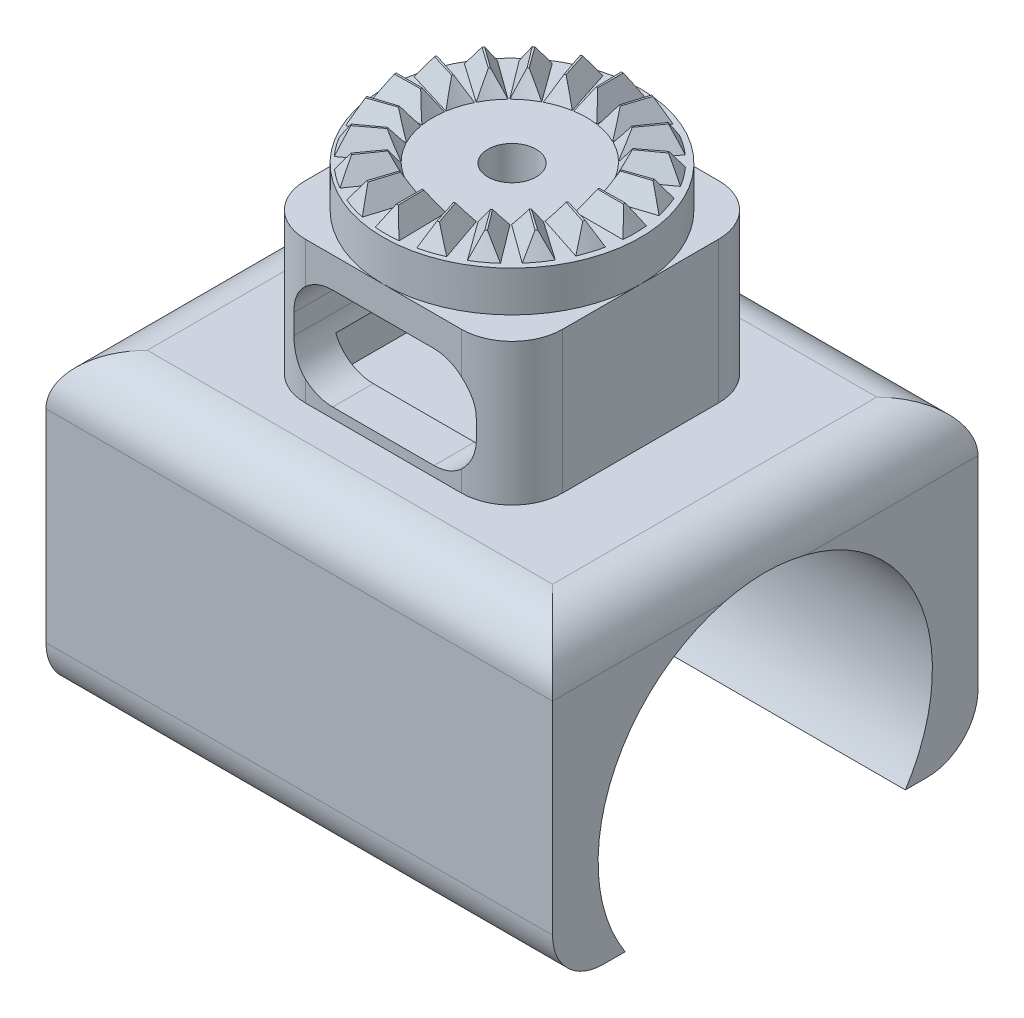
from build123d import *

# Parameters (mm, degrees)
CROQUIS1_W              = 12.7
CROQUIS1_H              = 10
SALIENTE_EXTRUIR1_DEPTH = 2
SALIENTE_EXTRUIR1_DRAFT = 28
MATRIZC1_COPY_1_DEPTH   = 2
MATRIZC1_COPY_1_DRAFT   = 28
MATRIZC1_COPY_2_DEPTH   = 2
MATRIZC1_COPY_2_DRAFT   = 28
MATRIZC1_COPY_3_DEPTH   = 2
MATRIZC1_COPY_3_DRAFT   = 28
MATRIZC1_COPY_4_DEPTH   = 2
MATRIZC1_COPY_4_DRAFT   = 28
MATRIZC1_COPY_5_DEPTH   = 2
MATRIZC1_COPY_5_DRAFT   = 28
MATRIZC1_COPY_6_DEPTH   = 2
MATRIZC1_COPY_6_DRAFT   = 28
MATRIZC1_COPY_7_DEPTH   = 2
MATRIZC1_COPY_7_DRAFT   = 28
MATRIZC1_COPY_8_DEPTH   = 2
MATRIZC1_COPY_8_DRAFT   = 28
MATRIZC1_COPY_9_DEPTH   = 2
MATRIZC1_COPY_9_DRAFT   = 28
MATRIZC1_COPY_10_DEPTH  = 2
MATRIZC1_COPY_10_DRAFT  = 28
MATRIZC1_COPY_11_DEPTH  = 2
MATRIZC1_COPY_11_DRAFT  = 28
MATRIZC1_COPY_12_DEPTH  = 2
MATRIZC1_COPY_12_DRAFT  = 28
MATRIZC1_COPY_13_DEPTH  = 2
MATRIZC1_COPY_13_DRAFT  = 28
MATRIZC1_COPY_14_DEPTH  = 2
MATRIZC1_COPY_14_DRAFT  = 28
MATRIZC1_COPY_15_DEPTH  = 2
MATRIZC1_COPY_15_DRAFT  = 28
MATRIZC1_COPY_16_DEPTH  = 2
MATRIZC1_COPY_16_DRAFT  = 28
MATRIZC1_COPY_17_DEPTH  = 2
MATRIZC1_COPY_17_DRAFT  = 28
MATRIZC1_COPY_18_DEPTH  = 2
MATRIZC1_COPY_18_DRAFT  = 28
MATRIZC1_COPY_19_DEPTH  = 2
MATRIZC1_COPY_19_DRAFT  = 28
CROQUIS3_W              = 25.4
CROQUIS3_H              = 25.4
SALIENTE_EXTRUIR2_DEPTH = 6
CROQUIS5_W              = 25.4
CROQUIS5_H              = 25.4
CROQUIS5_W_2            = 17.4
CROQUIS5_H_2            = 17.4
SALIENTE_EXTRUIR3_DEPTH = 8
CROQUIS7_W              = 50
CROQUIS7_H              = 30
SALIENTE_EXTRUIR4_DEPTH = 21
CORTAR_EXTRUIR2_DEPTH   = 72
REDONDEO2_R             = 5
CORTAR_EXTRUIR3_DEPTH   = 72
CROQUIS10_R             = 2.38125
CORTAR_EXTRUIR4_DEPTH   = 12
REDONDEO3_R             = 5
REDONDEO4_R             = 5


# Read off the part's stored shape, not the designer's step: Saliente-Extruir1
with BuildPart() as part:
    # Croquis1 → Revolución1 (revolve)
    with BuildSketch(Plane.XY, mode=Mode.PRIVATE) as revoluci_n1_sk:
        with Locations((-6.35, 5)):
            Rectangle(CROQUIS1_W, CROQUIS1_H)
    revolve(revoluci_n1_sk.sketch.rotate(Axis((0, -25.690422283, 0), (0, 1, 0)), 270), axis=Axis((0, -25.690422283, 0), (0, 1, 0)))


with BuildPart() as saliente_extruir1_tool:
    # Saliente-Extruir1 outline → Saliente-Extruir1 (with draft: the straight prism first)
    with BuildSketch(Plane(origin=(0, 12, 0), x_dir=(1, 0, 0), z_dir=(0, 1, 0))):
        with BuildLine():
            ThreePointArc((8.438714547, 0.14729831), (8.439678631, 0.07365196), (8.44, 0))
            Line((8.44, 0), (11, 0))
            ThreePointArc((11, 0), (10.999581154, 0.09599189), (10.998324647, 0.191976471))
            Line((10.998324647, 0.191976471), (8.438714547, 0.14729831))
        make_face()
    extrude(amount=-SALIENTE_EXTRUIR1_DEPTH)
    # Saliente-Extruir1: the draft: its side faces are tilted about the plane it starts from
    saliente_extruir1_sides = [saliente_extruir1_tool.faces().sort_by_distance(p)[0] for p in [
        (9.718519597, 11, -0.16963739),
        (8.439678631, 11, -0.073651959),
        (9.72, 11, 0),
        (10.999581154, 11, -0.095991891),
    ]]
    draft(saliente_extruir1_sides, Plane(origin=(0, 12, 0), x_dir=(1, 0, 0), z_dir=(0, 1, 0)), SALIENTE_EXTRUIR1_DRAFT)


with BuildPart() as part_1:
    add(part.part)

    # Saliente-Extruir1: add saliente_extruir1_tool
    add(saliente_extruir1_tool.part)


with BuildPart() as matrizc1_copy_1_tool:
    # MatrizC1 copy 1 sketch → MatrizC1 copy 1 (with draft: the straight prism first)
    with BuildSketch(Plane(origin=(-0.010903854, 12, -0.065158864), x_dir=(0.9510565162951535, 0, -0.3090169943749474), z_dir=(0, 1, 0))):
        with BuildLine():
            ThreePointArc((8.438714547, 0.14729831), (8.439678631, 0.07365196), (8.44, 0))
            Line((8.44, 0), (11, 0))
            ThreePointArc((11, 0), (10.999581154, 0.09599189), (10.998324647, 0.191976471))
            Line((10.998324647, 0.191976471), (8.438714547, 0.14729831))
        make_face()
    extrude(amount=-MATRIZC1_COPY_1_DEPTH)
    # MatrizC1 copy 1: the draft: its side faces are tilted about the plane it starts from
    matrizc1_copy_1_sides = [matrizc1_copy_1_tool.faces().sort_by_distance(p)[0] for p in [
        (9.179536701, 11, -3.229681324),
        (7.992947796, 11, -2.743210163),
        (9.233365484, 11, -3.068804049),
        (10.420656353, 11, -3.555510085),
    ]]
    draft(matrizc1_copy_1_sides, Plane(origin=(-0.010903854, 12, -0.065158864), x_dir=(0.9510565162951535, 0, -0.3090169943749474), z_dir=(0, 1, 0)), MATRIZC1_COPY_1_DRAFT)


with BuildPart() as part_2:
    add(part_1.part)

    # MatrizC1 copy 1: add matrizc1_copy_1_tool
    add(matrizc1_copy_1_tool.part)


with BuildPart() as matrizc1_copy_2_tool:
    # MatrizC1 copy 2 sketch → MatrizC1 copy 2 (with draft: the straight prism first)
    with BuildSketch(Plane(origin=(-0.041409232, 12, -0.123759149), x_dir=(0.8090169943749475, 0, -0.5877852522924731), z_dir=(0, 1, 0))):
        with BuildLine():
            ThreePointArc((8.438714547, 0.14729831), (8.439678631, 0.07365196), (8.44, 0))
            Line((8.44, 0), (11, 0))
            ThreePointArc((11, 0), (10.999581154, 0.09599189), (10.998324647, 0.191976471))
            Line((10.998324647, 0.191976471), (8.438714547, 0.14729831))
        make_face()
    extrude(amount=-MATRIZC1_COPY_2_DEPTH)
    # MatrizC1 copy 2: the draft: its side faces are tilted about the plane it starts from
    matrizc1_copy_2_sides = [matrizc1_copy_2_tool.faces().sort_by_distance(p)[0] for p in [
        (7.721327926, 11, -5.973401174),
        (6.743142672, 11, -5.144063469),
        (7.822235953, 11, -5.837031802),
        (8.801016235, 11, -6.666809804),
    ]]
    draft(matrizc1_copy_2_sides, Plane(origin=(-0.041409232, 12, -0.123759149), x_dir=(0.8090169943749475, 0, -0.5877852522924731), z_dir=(0, 1, 0)), MATRIZC1_COPY_2_DRAFT)


with BuildPart() as part_3:
    add(part_2.part)

    # MatrizC1 copy 2: add matrizc1_copy_2_tool
    add(matrizc1_copy_2_tool.part)


with BuildPart() as matrizc1_copy_3_tool:
    # MatrizC1 copy 3 sketch → MatrizC1 copy 3 (with draft: the straight prism first)
    with BuildSketch(Plane(origin=(-0.088530055, 12, -0.170064653), x_dir=(0.5877852522924731, 0, -0.8090169943749475), z_dir=(0, 1, 0))):
        with BuildLine():
            ThreePointArc((8.438714547, 0.14729831), (8.439678631, 0.07365196), (8.44, 0))
            Line((8.44, 0), (11, 0))
            ThreePointArc((11, 0), (10.999581154, 0.09599189), (10.998324647, 0.191976471))
            Line((10.998324647, 0.191976471), (8.438714547, 0.14729831))
        make_face()
    extrude(amount=-MATRIZC1_COPY_3_DEPTH)
    # MatrizC1 copy 3: the draft: its side faces are tilted about the plane it starts from
    matrizc1_copy_3_sides = [matrizc1_copy_3_tool.faces().sort_by_distance(p)[0] for p in [
        (5.486632907, 11, -8.132222523),
        (4.812602892, 11, -7.041199627),
        (5.624742598, 11, -8.033709838),
        (6.299202458, 11, -9.125335355),
    ]]
    draft(matrizc1_copy_3_sides, Plane(origin=(-0.088530055, 12, -0.170064653), x_dir=(0.5877852522924731, 0, -0.8090169943749475), z_dir=(0, 1, 0)), MATRIZC1_COPY_3_DRAFT)


with BuildPart() as part_4:
    add(part_3.part)

    # MatrizC1 copy 3: add matrizc1_copy_3_tool
    add(matrizc1_copy_3_tool.part)


with BuildPart() as matrizc1_copy_4_tool:
    # MatrizC1 copy 4 sketch → MatrizC1 copy 4 (with draft: the straight prism first)
    with BuildSketch(Plane(origin=(-0.147653807, 12, -0.199542668), x_dir=(0.30901699437494745, 0, -0.9510565162951535), z_dir=(0, 1, 0))):
        with BuildLine():
            ThreePointArc((8.438714547, 0.14729831), (8.439678631, 0.07365196), (8.44, 0))
            Line((8.44, 0), (11, 0))
            ThreePointArc((11, 0), (10.999581154, 0.09599189), (10.998324647, 0.191976471))
            Line((10.998324647, 0.191976471), (8.438714547, 0.14729831))
        make_face()
    extrude(amount=-MATRIZC1_COPY_4_DEPTH)
    # MatrizC1 copy 4: the draft: its side faces are tilted about the plane it starts from
    matrizc1_copy_4_sides = [matrizc1_copy_4_tool.faces().sort_by_distance(p)[0] for p in [
        (2.694199163, 11, -9.494824896),
        (2.390303141, 11, -8.248913733),
        (2.855991378, 11, -9.443812007),
        (3.160109987, 11, -10.690429127),
    ]]
    draft(matrizc1_copy_4_sides, Plane(origin=(-0.147653807, 12, -0.199542668), x_dir=(0.30901699437494745, 0, -0.9510565162951535), z_dir=(0, 1, 0)), MATRIZC1_COPY_4_DRAFT)


with BuildPart() as part_5:
    add(part_4.part)

    # MatrizC1 copy 4: add matrizc1_copy_4_tool
    add(matrizc1_copy_4_tool.part)


with BuildPart() as matrizc1_copy_5_tool:
    # MatrizC1 copy 5 sketch → MatrizC1 copy 5 (with draft: the straight prism first)
    with BuildSketch(Plane(origin=(-0.212993046, 12, -0.209307683), x_dir=(0, 0, -1), z_dir=(0, 1, 0))):
        with BuildLine():
            ThreePointArc((8.438714547, 0.14729831), (8.439678631, 0.07365196), (8.44, 0))
            Line((8.44, 0), (11, 0))
            ThreePointArc((11, 0), (10.999581154, 0.09599189), (10.998324647, 0.191976471))
            Line((10.998324647, 0.191976471), (8.438714547, 0.14729831))
        make_face()
    extrude(amount=-MATRIZC1_COPY_5_DEPTH)
    # MatrizC1 copy 5: the draft: its side faces are tilted about the plane it starts from
    matrizc1_copy_5_sides = [matrizc1_copy_5_tool.faces().sort_by_distance(p)[0] for p in [
        (-0.382630436, 11, -9.92782728),
        (-0.286645005, 11, -8.648986314),
        (-0.212993046, 11, -9.929307683),
        (-0.308984937, 11, -11.208888837),
    ]]
    draft(matrizc1_copy_5_sides, Plane(origin=(-0.212993046, 12, -0.209307683), x_dir=(0, 0, -1), z_dir=(0, 1, 0)), MATRIZC1_COPY_5_DRAFT)


with BuildPart() as part_6:
    add(part_5.part)

    # MatrizC1 copy 5: add matrizc1_copy_5_tool
    add(matrizc1_copy_5_tool.part)


with BuildPart() as matrizc1_copy_6_tool:
    # MatrizC1 copy 6 sketch → MatrizC1 copy 6 (with draft: the straight prism first)
    with BuildSketch(Plane(origin=(-0.278151909, 12, -0.198403829), x_dir=(-0.30901699437494734, 0, -0.9510565162951536), z_dir=(0, 1, 0))):
        with BuildLine():
            ThreePointArc((8.438714547, 0.14729831), (8.439678631, 0.07365196), (8.44, 0))
            Line((8.44, 0), (11, 0))
            ThreePointArc((11, 0), (10.999581154, 0.09599189), (10.998324647, 0.191976471))
            Line((10.998324647, 0.191976471), (8.438714547, 0.14729831))
        make_face()
    extrude(amount=-MATRIZC1_COPY_6_DEPTH)
    # MatrizC1 copy 6: the draft: its side faces are tilted about the plane it starts from
    matrizc1_copy_6_sides = [matrizc1_copy_6_tool.faces().sort_by_distance(p)[0] for p in [
        (-3.44267437, 11, -9.388844384),
        (-2.956203209, 11, -8.202255479),
        (-3.281797095, 11, -9.442673167),
        (-3.76850313, 11, -10.629964036),
    ]]
    draft(matrizc1_copy_6_sides, Plane(origin=(-0.278151909, 12, -0.198403829), x_dir=(-0.30901699437494734, 0, -0.9510565162951536), z_dir=(0, 1, 0)), MATRIZC1_COPY_6_DRAFT)


with BuildPart() as part_7:
    add(part_6.part)

    # MatrizC1 copy 6: add matrizc1_copy_6_tool
    add(matrizc1_copy_6_tool.part)


with BuildPart() as matrizc1_copy_7_tool:
    # MatrizC1 copy 7 sketch → MatrizC1 copy 7 (with draft: the straight prism first)
    with BuildSketch(Plane(origin=(-0.336752195, 12, -0.167898451), x_dir=(-0.587785252292473, 0, -0.8090169943749475), z_dir=(0, 1, 0))):
        with BuildLine():
            ThreePointArc((8.438714547, 0.14729831), (8.439678631, 0.07365196), (8.44, 0))
            Line((8.44, 0), (11, 0))
            ThreePointArc((11, 0), (10.999581154, 0.09599189), (10.998324647, 0.191976471))
            Line((10.998324647, 0.191976471), (8.438714547, 0.14729831))
        make_face()
    extrude(amount=-MATRIZC1_COPY_7_DEPTH)
    # MatrizC1 copy 7: the draft: its side faces are tilted about the plane it starts from
    matrizc1_copy_7_sides = [matrizc1_copy_7_tool.faces().sort_by_distance(p)[0] for p in [
        (-6.186394219, 11, -7.930635609),
        (-5.357056515, 11, -6.952450355),
        (-6.050024847, 11, -8.031543636),
        (-6.87980285, 11, -9.010323918),
    ]]
    draft(matrizc1_copy_7_sides, Plane(origin=(-0.336752195, 12, -0.167898451), x_dir=(-0.587785252292473, 0, -0.8090169943749475), z_dir=(0, 1, 0)), MATRIZC1_COPY_7_DRAFT)


with BuildPart() as part_8:
    add(part_7.part)

    # MatrizC1 copy 7: add matrizc1_copy_7_tool
    add(matrizc1_copy_7_tool.part)


with BuildPart() as matrizc1_copy_8_tool:
    # MatrizC1 copy 8 sketch → MatrizC1 copy 8 (with draft: the straight prism first)
    with BuildSketch(Plane(origin=(-0.383057698, 12, -0.120777628), x_dir=(-0.8090169943749473, 0, -0.5877852522924732), z_dir=(0, 1, 0))):
        with BuildLine():
            ThreePointArc((8.438714547, 0.14729831), (8.439678631, 0.07365196), (8.44, 0))
            Line((8.44, 0), (11, 0))
            ThreePointArc((11, 0), (10.999581154, 0.09599189), (10.998324647, 0.191976471))
            Line((10.998324647, 0.191976471), (8.438714547, 0.14729831))
        make_face()
    extrude(amount=-MATRIZC1_COPY_8_DEPTH)
    # MatrizC1 copy 8: the draft: its side faces are tilted about the plane it starts from
    matrizc1_copy_8_sides = [matrizc1_copy_8_tool.faces().sort_by_distance(p)[0] for p in [
        (-8.345215568, 11, -5.69594059),
        (-7.254192673, 11, -5.021910575),
        (-8.246702884, 11, -5.834050281),
        (-9.338328401, 11, -6.508510141),
    ]]
    draft(matrizc1_copy_8_sides, Plane(origin=(-0.383057698, 12, -0.120777628), x_dir=(-0.8090169943749473, 0, -0.5877852522924732), z_dir=(0, 1, 0)), MATRIZC1_COPY_8_DRAFT)


with BuildPart() as part_9:
    add(part_8.part)

    # MatrizC1 copy 8: add matrizc1_copy_8_tool
    add(matrizc1_copy_8_tool.part)


with BuildPart() as matrizc1_copy_9_tool:
    # MatrizC1 copy 9 sketch → MatrizC1 copy 9 (with draft: the straight prism first)
    with BuildSketch(Plane(origin=(-0.412535714, 12, -0.061653876), x_dir=(-0.9510565162951535, 0, -0.3090169943749475), z_dir=(0, 1, 0))):
        with BuildLine():
            ThreePointArc((8.438714547, 0.14729831), (8.439678631, 0.07365196), (8.44, 0))
            Line((8.44, 0), (11, 0))
            ThreePointArc((11, 0), (10.999581154, 0.09599189), (10.998324647, 0.191976471))
            Line((10.998324647, 0.191976471), (8.438714547, 0.14729831))
        make_face()
    extrude(amount=-MATRIZC1_COPY_9_DEPTH)
    # MatrizC1 copy 9: the draft: its side faces are tilted about the plane it starts from
    matrizc1_copy_9_sides = [matrizc1_copy_9_tool.faces().sort_by_distance(p)[0] for p in [
        (-9.707817942, 11, -2.903506846),
        (-8.461906778, 11, -2.599610824),
        (-9.656805052, 11, -3.065299061),
        (-10.903422173, 11, -3.36941767),
    ]]
    draft(matrizc1_copy_9_sides, Plane(origin=(-0.412535714, 12, -0.061653876), x_dir=(-0.9510565162951535, 0, -0.3090169943749475), z_dir=(0, 1, 0)), MATRIZC1_COPY_9_DRAFT)


with BuildPart() as part_10:
    add(part_9.part)

    # MatrizC1 copy 9: add matrizc1_copy_9_tool
    add(matrizc1_copy_9_tool.part)


with BuildPart() as matrizc1_copy_10_tool:
    # MatrizC1 copy 10 sketch → MatrizC1 copy 10 (with draft: the straight prism first)
    with BuildSketch(Plane(origin=(-0.422300729, 12, 0.003685363), x_dir=(-1, 0, 0), z_dir=(0, 1, 0))):
        with BuildLine():
            ThreePointArc((8.438714547, 0.14729831), (8.439678631, 0.07365196), (8.44, 0))
            Line((8.44, 0), (11, 0))
            ThreePointArc((11, 0), (10.999581154, 0.09599189), (10.998324647, 0.191976471))
            Line((10.998324647, 0.191976471), (8.438714547, 0.14729831))
        make_face()
    extrude(amount=-MATRIZC1_COPY_10_DEPTH)
    # MatrizC1 copy 10: the draft: its side faces are tilted about the plane it starts from
    matrizc1_copy_10_sides = [matrizc1_copy_10_tool.faces().sort_by_distance(p)[0] for p in [
        (-10.140820326, 11, 0.173322753),
        (-8.86197936, 11, 0.077337322),
        (-10.142300729, 11, 0.003685363),
        (-11.421881883, 11, 0.099677254),
    ]]
    draft(matrizc1_copy_10_sides, Plane(origin=(-0.422300729, 12, 0.003685363), x_dir=(-1, 0, 0), z_dir=(0, 1, 0)), MATRIZC1_COPY_10_DRAFT)


with BuildPart() as part_11:
    add(part_10.part)

    # MatrizC1 copy 10: add matrizc1_copy_10_tool
    add(matrizc1_copy_10_tool.part)


with BuildPart() as matrizc1_copy_11_tool:
    # MatrizC1 copy 11 sketch → MatrizC1 copy 11 (with draft: the straight prism first)
    with BuildSketch(Plane(origin=(-0.411396874, 12, 0.068844226), x_dir=(-0.9510565162951536, 0, 0.3090169943749473), z_dir=(0, 1, 0))):
        with BuildLine():
            ThreePointArc((8.438714547, 0.14729831), (8.439678631, 0.07365196), (8.44, 0))
            Line((8.44, 0), (11, 0))
            ThreePointArc((11, 0), (10.999581154, 0.09599189), (10.998324647, 0.191976471))
            Line((10.998324647, 0.191976471), (8.438714547, 0.14729831))
        make_face()
    extrude(amount=-MATRIZC1_COPY_11_DEPTH)
    # MatrizC1 copy 11: the draft: its side faces are tilted about the plane it starts from
    matrizc1_copy_11_sides = [matrizc1_copy_11_tool.faces().sort_by_distance(p)[0] for p in [
        (-9.601837429, 11, 3.233366687),
        (-8.415248525, 11, 2.746895526),
        (-9.655666213, 11, 3.072489412),
        (-10.842957082, 11, 3.559195447),
    ]]
    draft(matrizc1_copy_11_sides, Plane(origin=(-0.411396874, 12, 0.068844226), x_dir=(-0.9510565162951536, 0, 0.3090169943749473), z_dir=(0, 1, 0)), MATRIZC1_COPY_11_DRAFT)


with BuildPart() as part_12:
    add(part_11.part)

    # MatrizC1 copy 11: add matrizc1_copy_11_tool
    add(matrizc1_copy_11_tool.part)


with BuildPart() as matrizc1_copy_12_tool:
    # MatrizC1 copy 12 sketch → MatrizC1 copy 12 (with draft: the straight prism first)
    with BuildSketch(Plane(origin=(-0.380891496, 12, 0.127444512), x_dir=(-0.8090169943749476, 0, 0.587785252292473), z_dir=(0, 1, 0))):
        with BuildLine():
            ThreePointArc((8.438714547, 0.14729831), (8.439678631, 0.07365196), (8.44, 0))
            Line((8.44, 0), (11, 0))
            ThreePointArc((11, 0), (10.999581154, 0.09599189), (10.998324647, 0.191976471))
            Line((10.998324647, 0.191976471), (8.438714547, 0.14729831))
        make_face()
    extrude(amount=-MATRIZC1_COPY_12_DEPTH)
    # MatrizC1 copy 12: the draft: its side faces are tilted about the plane it starts from
    matrizc1_copy_12_sides = [matrizc1_copy_12_tool.faces().sort_by_distance(p)[0] for p in [
        (-8.143628654, 11, 5.977086537),
        (-7.165443401, 11, 5.147748832),
        (-8.244536682, 11, 5.840717164),
        (-9.223316963, 11, 6.670495167),
    ]]
    draft(matrizc1_copy_12_sides, Plane(origin=(-0.380891496, 12, 0.127444512), x_dir=(-0.8090169943749476, 0, 0.587785252292473), z_dir=(0, 1, 0)), MATRIZC1_COPY_12_DRAFT)


with BuildPart() as part_13:
    add(part_12.part)

    # MatrizC1 copy 12: add matrizc1_copy_12_tool
    add(matrizc1_copy_12_tool.part)


with BuildPart() as matrizc1_copy_13_tool:
    # MatrizC1 copy 13 sketch → MatrizC1 copy 13 (with draft: the straight prism first)
    with BuildSketch(Plane(origin=(-0.333770674, 12, 0.173750015), x_dir=(-0.5877852522924732, 0, 0.8090169943749473), z_dir=(0, 1, 0))):
        with BuildLine():
            ThreePointArc((8.438714547, 0.14729831), (8.439678631, 0.07365196), (8.44, 0))
            Line((8.44, 0), (11, 0))
            ThreePointArc((11, 0), (10.999581154, 0.09599189), (10.998324647, 0.191976471))
            Line((10.998324647, 0.191976471), (8.438714547, 0.14729831))
        make_face()
    extrude(amount=-MATRIZC1_COPY_13_DEPTH)
    # MatrizC1 copy 13: the draft: its side faces are tilted about the plane it starts from
    matrizc1_copy_13_sides = [matrizc1_copy_13_tool.faces().sort_by_distance(p)[0] for p in [
        (-5.908933636, 11, 8.135907885),
        (-5.234903621, 11, 7.04488499),
        (-6.047043326, 11, 8.037395201),
        (-6.721503186, 11, 9.129020718),
    ]]
    draft(matrizc1_copy_13_sides, Plane(origin=(-0.333770674, 12, 0.173750015), x_dir=(-0.5877852522924732, 0, 0.8090169943749473), z_dir=(0, 1, 0)), MATRIZC1_COPY_13_DRAFT)


with BuildPart() as part_14:
    add(part_13.part)

    # MatrizC1 copy 13: add matrizc1_copy_13_tool
    add(matrizc1_copy_13_tool.part)


with BuildPart() as matrizc1_copy_14_tool:
    # MatrizC1 copy 14 sketch → MatrizC1 copy 14 (with draft: the straight prism first)
    with BuildSketch(Plane(origin=(-0.274646921, 12, 0.203228031), x_dir=(-0.30901699437494756, 0, 0.9510565162951535), z_dir=(0, 1, 0))):
        with BuildLine():
            ThreePointArc((8.438714547, 0.14729831), (8.439678631, 0.07365196), (8.44, 0))
            Line((8.44, 0), (11, 0))
            ThreePointArc((11, 0), (10.999581154, 0.09599189), (10.998324647, 0.191976471))
            Line((10.998324647, 0.191976471), (8.438714547, 0.14729831))
        make_face()
    extrude(amount=-MATRIZC1_COPY_14_DEPTH)
    # MatrizC1 copy 14: the draft: its side faces are tilted about the plane it starts from
    matrizc1_copy_14_sides = [matrizc1_copy_14_tool.faces().sort_by_distance(p)[0] for p in [
        (-3.116499892, 11, 9.498510259),
        (-2.81260387, 11, 8.252599095),
        (-3.278292106, 11, 9.447497369),
        (-3.582410715, 11, 10.69411449),
    ]]
    draft(matrizc1_copy_14_sides, Plane(origin=(-0.274646921, 12, 0.203228031), x_dir=(-0.30901699437494756, 0, 0.9510565162951535), z_dir=(0, 1, 0)), MATRIZC1_COPY_14_DRAFT)


with BuildPart() as part_15:
    add(part_14.part)

    # MatrizC1 copy 14: add matrizc1_copy_14_tool
    add(matrizc1_copy_14_tool.part)


with BuildPart() as matrizc1_copy_15_tool:
    # MatrizC1 copy 15 sketch → MatrizC1 copy 15 (with draft: the straight prism first)
    with BuildSketch(Plane(origin=(-0.209307683, 12, 0.212993046), x_dir=(0, 0, 1), z_dir=(0, 1, 0))):
        with BuildLine():
            ThreePointArc((8.438714547, 0.14729831), (8.439678631, 0.07365196), (8.44, 0))
            Line((8.44, 0), (11, 0))
            ThreePointArc((11, 0), (10.999581154, 0.09599189), (10.998324647, 0.191976471))
            Line((10.998324647, 0.191976471), (8.438714547, 0.14729831))
        make_face()
    extrude(amount=-MATRIZC1_COPY_15_DEPTH)
    # MatrizC1 copy 15: the draft: its side faces are tilted about the plane it starts from
    matrizc1_copy_15_sides = [matrizc1_copy_15_tool.faces().sort_by_distance(p)[0] for p in [
        (-0.039670293, 11, 9.931512643),
        (-0.135655724, 11, 8.652671677),
        (-0.209307683, 11, 9.932993046),
        (-0.113315792, 11, 11.2125742),
    ]]
    draft(matrizc1_copy_15_sides, Plane(origin=(-0.209307683, 12, 0.212993046), x_dir=(0, 0, 1), z_dir=(0, 1, 0)), MATRIZC1_COPY_15_DRAFT)


with BuildPart() as part_16:
    add(part_15.part)

    # MatrizC1 copy 15: add matrizc1_copy_15_tool
    add(matrizc1_copy_15_tool.part)


with BuildPart() as matrizc1_copy_16_tool:
    # MatrizC1 copy 16 sketch → MatrizC1 copy 16 (with draft: the straight prism first)
    with BuildSketch(Plane(origin=(-0.144148819, 12, 0.202089191), x_dir=(0.30901699437494723, 0, 0.9510565162951536), z_dir=(0, 1, 0))):
        with BuildLine():
            ThreePointArc((8.438714547, 0.14729831), (8.439678631, 0.07365196), (8.44, 0))
            Line((8.44, 0), (11, 0))
            ThreePointArc((11, 0), (10.999581154, 0.09599189), (10.998324647, 0.191976471))
            Line((10.998324647, 0.191976471), (8.438714547, 0.14729831))
        make_face()
    extrude(amount=-MATRIZC1_COPY_16_DEPTH)
    # MatrizC1 copy 16: the draft: its side faces are tilted about the plane it starts from
    matrizc1_copy_16_sides = [matrizc1_copy_16_tool.faces().sort_by_distance(p)[0] for p in [
        (3.020373642, 11, 9.392529746),
        (2.53390248, 11, 8.205940842),
        (2.859496366, 11, 9.44635853),
        (3.346202402, 11, 10.633649399),
    ]]
    draft(matrizc1_copy_16_sides, Plane(origin=(-0.144148819, 12, 0.202089191), x_dir=(0.30901699437494723, 0, 0.9510565162951536), z_dir=(0, 1, 0)), MATRIZC1_COPY_16_DRAFT)


with BuildPart() as part_17:
    add(part_16.part)

    # MatrizC1 copy 16: add matrizc1_copy_16_tool
    add(matrizc1_copy_16_tool.part)


with BuildPart() as matrizc1_copy_17_tool:
    # MatrizC1 copy 17 sketch → MatrizC1 copy 17 (with draft: the straight prism first)
    with BuildSketch(Plane(origin=(-0.085548534, 12, 0.171583813), x_dir=(0.5877852522924729, 0, 0.8090169943749476), z_dir=(0, 1, 0))):
        with BuildLine():
            ThreePointArc((8.438714547, 0.14729831), (8.439678631, 0.07365196), (8.44, 0))
            Line((8.44, 0), (11, 0))
            ThreePointArc((11, 0), (10.999581154, 0.09599189), (10.998324647, 0.191976471))
            Line((10.998324647, 0.191976471), (8.438714547, 0.14729831))
        make_face()
    extrude(amount=-MATRIZC1_COPY_17_DEPTH)
    # MatrizC1 copy 17: the draft: its side faces are tilted about the plane it starts from
    matrizc1_copy_17_sides = [matrizc1_copy_17_tool.faces().sort_by_distance(p)[0] for p in [
        (5.764093491, 11, 7.934320972),
        (4.934755786, 11, 6.956135718),
        (5.627724119, 11, 8.035228999),
        (6.457502121, 11, 9.01400928),
    ]]
    draft(matrizc1_copy_17_sides, Plane(origin=(-0.085548534, 12, 0.171583813), x_dir=(0.5877852522924729, 0, 0.8090169943749476), z_dir=(0, 1, 0)), MATRIZC1_COPY_17_DRAFT)


with BuildPart() as part_18:
    add(part_17.part)

    # MatrizC1 copy 17: add matrizc1_copy_17_tool
    add(matrizc1_copy_17_tool.part)


with BuildPart() as matrizc1_copy_18_tool:
    # MatrizC1 copy 18 sketch → MatrizC1 copy 18 (with draft: the straight prism first)
    with BuildSketch(Plane(origin=(-0.03924303, 12, 0.124462991), x_dir=(0.8090169943749473, 0, 0.5877852522924734), z_dir=(0, 1, 0))):
        with BuildLine():
            ThreePointArc((8.438714547, 0.14729831), (8.439678631, 0.07365196), (8.44, 0))
            Line((8.44, 0), (11, 0))
            ThreePointArc((11, 0), (10.999581154, 0.09599189), (10.998324647, 0.191976471))
            Line((10.998324647, 0.191976471), (8.438714547, 0.14729831))
        make_face()
    extrude(amount=-MATRIZC1_COPY_18_DEPTH)
    # MatrizC1 copy 18: the draft: its side faces are tilted about the plane it starts from
    matrizc1_copy_18_sides = [matrizc1_copy_18_tool.faces().sort_by_distance(p)[0] for p in [
        (7.92291484, 11, 5.699625953),
        (6.831891945, 11, 5.025595938),
        (7.824402155, 11, 5.837735643),
        (8.916027672, 11, 6.512195504),
    ]]
    draft(matrizc1_copy_18_sides, Plane(origin=(-0.03924303, 12, 0.124462991), x_dir=(0.8090169943749473, 0, 0.5877852522924734), z_dir=(0, 1, 0)), MATRIZC1_COPY_18_DRAFT)


with BuildPart() as part_19:
    add(part_18.part)

    # MatrizC1 copy 18: add matrizc1_copy_18_tool
    add(matrizc1_copy_18_tool.part)


with BuildPart() as matrizc1_copy_19_tool:
    # MatrizC1 copy 19 sketch → MatrizC1 copy 19 (with draft: the straight prism first)
    with BuildSketch(Plane(origin=(-0.009765015, 12, 0.065339238), x_dir=(0.9510565162951535, 0, 0.3090169943749476), z_dir=(0, 1, 0))):
        with BuildLine():
            ThreePointArc((8.438714547, 0.14729831), (8.439678631, 0.07365196), (8.44, 0))
            Line((8.44, 0), (11, 0))
            ThreePointArc((11, 0), (10.999581154, 0.09599189), (10.998324647, 0.191976471))
            Line((10.998324647, 0.191976471), (8.438714547, 0.14729831))
        make_face()
    extrude(amount=-MATRIZC1_COPY_19_DEPTH)
    # MatrizC1 copy 19: the draft: its side faces are tilted about the plane it starts from
    matrizc1_copy_19_sides = [matrizc1_copy_19_tool.faces().sort_by_distance(p)[0] for p in [
        (9.285517213, 11, 2.907192209),
        (8.03960605, 11, 2.603296187),
        (9.234504324, 11, 3.068984423),
        (10.481121444, 11, 3.373103032),
    ]]
    draft(matrizc1_copy_19_sides, Plane(origin=(-0.009765015, 12, 0.065339238), x_dir=(0.9510565162951535, 0, 0.3090169943749476), z_dir=(0, 1, 0)), MATRIZC1_COPY_19_DRAFT)


with BuildPart() as part_20:
    add(part_19.part)

    # MatrizC1 copy 19: add matrizc1_copy_19_tool
    add(matrizc1_copy_19_tool.part)

    # Croquis3 → Saliente-Extruir2 (add)
    with BuildSketch(Plane.XZ):
        Rectangle(CROQUIS3_W, CROQUIS3_H)
    extrude(amount=-SALIENTE_EXTRUIR2_DEPTH)

    # Croquis5 → Saliente-Extruir3 (add)
    with BuildSketch(Plane.XZ):
        Rectangle(CROQUIS5_W, CROQUIS5_H)
        Rectangle(CROQUIS5_W_2, CROQUIS5_H_2, mode=Mode.SUBTRACT)
    extrude(amount=SALIENTE_EXTRUIR3_DEPTH)

    # Croquis7 → Saliente-Extruir4 (add, symmetric)
    with BuildSketch(Plane.XY):
        with Locations((0, -23)):
            Rectangle(CROQUIS7_W, CROQUIS7_H)
    extrude(amount=SALIENTE_EXTRUIR4_DEPTH, both=True)

    # Croquis8 → Cortar-Extruir2 (cut)
    with BuildSketch(Plane.ZY.offset(25)):
        with BuildLine():
            ThreePointArc((16.5, -29), (0, -12.5), (-16.5, -29))
            Line((-16.5, -29), (16.5, -29))
        make_face()
        with BuildLine():
            Line((16.5, -29), (-16.5, -29))
            ThreePointArc((-16.5, -29), (-15.818244614, -33.693946883), (-13.829316686, -38))
            Line((-13.829316686, -38), (13.829316686, -38))
            ThreePointArc((13.829316686, -38), (15.818244614, -33.693946883), (16.5, -29))
        make_face()
    extrude(amount=-CORTAR_EXTRUIR2_DEPTH, mode=Mode.SUBTRACT)

    # Redondeo2
    # the kernel refuses this fillet: 5 mm, written as the material it takes off along each edge
    with BuildSketch(Plane(origin=(-37.5, -8, -21), x_dir=(0, 0, 1), z_dir=(1, 0, 0))) as redondeo2_piece_1:
        with BuildLine():
            CenterArc((REDONDEO2_R, REDONDEO2_R), REDONDEO2_R, 180, 90)
            Line((0, REDONDEO2_R), (0, 0))
            Line((0, 0), (REDONDEO2_R, 0))
        make_face()
    extrude(amount=75, mode=Mode.SUBTRACT)
    with BuildSketch(Plane(origin=(25, -8, 33.5), x_dir=(-1, 0, 0), z_dir=(0, 0, -1)), Plane(origin=(-25, -8, -33.5), x_dir=(1, 0, 0), z_dir=(0, 0, 1))) as redondeo2_piece_2:
        with BuildLine():
            CenterArc((REDONDEO2_R, -REDONDEO2_R), REDONDEO2_R, 90, 90)
            Line((0, -REDONDEO2_R), (0, 0))
            Line((0, 0), (REDONDEO2_R, 0))
        make_face()
    extrude(amount=67, mode=Mode.SUBTRACT)
    with BuildSketch(Plane(origin=(-37.5, -8, 21), x_dir=(0, 0, -1), z_dir=(1, 0, 0))) as redondeo2_piece_3:
        with BuildLine():
            CenterArc((REDONDEO2_R, -REDONDEO2_R), REDONDEO2_R, 90, 90)
            Line((0, -REDONDEO2_R), (0, 0))
            Line((0, 0), (REDONDEO2_R, 0))
        make_face()
    extrude(amount=75, mode=Mode.SUBTRACT)

    # Croquis9 → Cortar-Extruir3 (cut)
    with BuildSketch(Plane(origin=(0, 0, -12.7), x_dir=(-1, 0, 0), z_dir=(0, 0, -1))):
        with BuildLine():
            Line((-9, -3), (-9, -1))
            ThreePointArc((-9, -1), (-7.828427125, 1.828427125), (-5, 3))
            Line((-5, 3), (5, 3))
            ThreePointArc((5, 3), (7.828427125, 1.828427125), (9, -1))
            Line((9, -1), (9, -3))
            ThreePointArc((9, -3), (7.828427125, -5.828427125), (5, -7))
            Line((5, -7), (-5, -7))
            ThreePointArc((-5, -7), (-7.828427125, -5.828427125), (-9, -3))
        make_face()
    extrude(amount=-CORTAR_EXTRUIR3_DEPTH, mode=Mode.SUBTRACT)

    # Croquis10 → Cortar-Extruir4 (cut)
    with BuildSketch(Plane(origin=(0, 12, 0), x_dir=(1, 0, 0), z_dir=(0, 1, 0))):
        with Locations(Location((0, 0, 0), (0, 0, 180))):
            Circle(CROQUIS10_R)
    extrude(amount=-CORTAR_EXTRUIR4_DEPTH, mode=Mode.SUBTRACT)

    # Redondeo3
    redondeo3_edges = [part_20.edges().sort_by_distance(p)[0] for p in [
        (0, -38, -21),
        (0, -38, 21),
    ]]
    fillet(redondeo3_edges, radius=REDONDEO3_R)

    # Redondeo4
    # the kernel refuses this fillet: 5 mm, written as the material it takes off along each edge
    with BuildSketch(Plane(origin=(12.7, 18.5, -12.7), x_dir=(-1, 0, 0), z_dir=(0, -1, 0)), Plane(origin=(-12.7, 18.5, -12.7), x_dir=(0, 0, 1), z_dir=(0, -1, 0)), Plane(origin=(-12.7, -8, 12.7), x_dir=(0, 0, -1), z_dir=(0, 1, 0))) as redondeo4_piece_1:
        with BuildLine():
            CenterArc((REDONDEO4_R, -REDONDEO4_R), REDONDEO4_R, 90, 90)
            Line((0, -REDONDEO4_R), (0, 0))
            Line((0, 0), (REDONDEO4_R, 0))
        make_face()
    extrude(amount=26.5, mode=Mode.SUBTRACT)
    with BuildSketch(Plane(origin=(12.7, 18.5, 12.7), x_dir=(-1, 0, 0), z_dir=(0, -1, 0))) as redondeo4_piece_2:
        with BuildLine():
            CenterArc((REDONDEO4_R, REDONDEO4_R), REDONDEO4_R, 180, 90)
            Line((0, REDONDEO4_R), (0, 0))
            Line((0, 0), (REDONDEO4_R, 0))
        make_face()
    extrude(amount=26.5, mode=Mode.SUBTRACT)


solid = part_20.part
